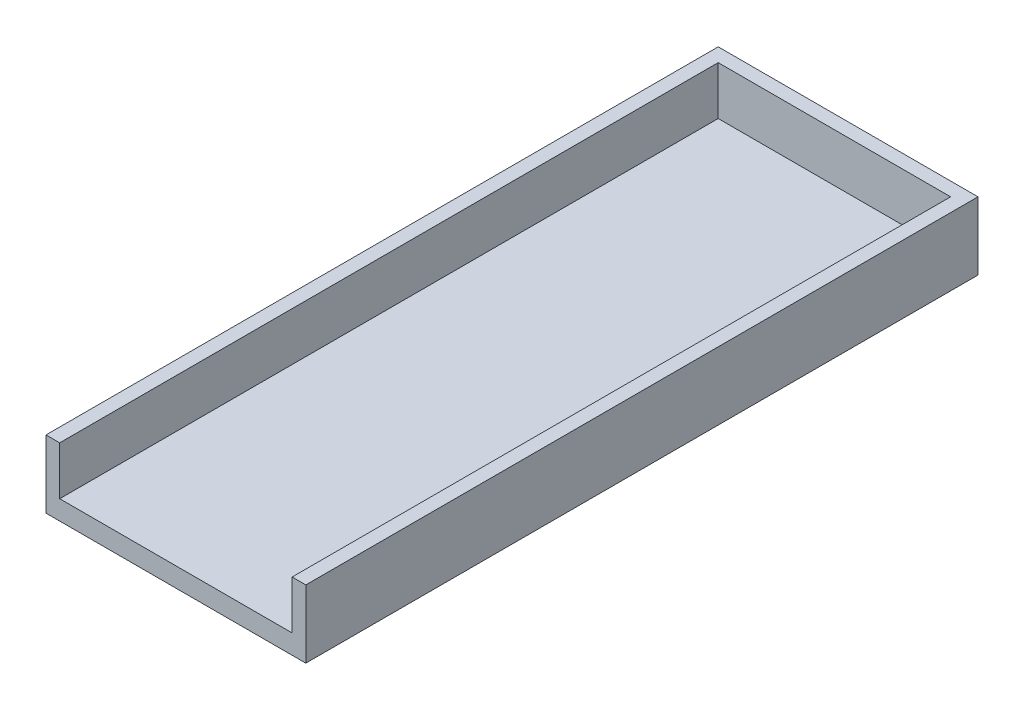
from build123d import *

# Parameters (mm, degrees)
SKETCH2_W             = 67.071067812
SKETCH2_H             = 337.071067812
SKETCH2_W_2           = 60
SKETCH2_H_2           = 330
BOSS_EXTRUDE1_DEPTH   = 12.5
SKETCH3_W             = 67.071067812
SKETCH3_H             = 337.071067812
BOSS_EXTRUDE2_DEPTH   = 5
BODY_MOVE_COPY2_ANGLE = 180
BOSS_EXTRUDE3_DEPTH   = 5


with BuildPart() as part:
    # Sketch2 → Boss-Extrude1 (new body)
    with BuildSketch(Plane(origin=(0, 0, 0), x_dir=(1, 0, 0), z_dir=(0, 1, 0))):
        with Locations((30, 165)):
            Rectangle(SKETCH2_W, SKETCH2_H)
        with Locations((30, 165)):
            Rectangle(SKETCH2_W_2, SKETCH2_H_2, mode=Mode.SUBTRACT)
    extrude(amount=BOSS_EXTRUDE1_DEPTH)

    # Sketch3 → Boss-Extrude2 (add)
    with BuildSketch(Plane.XZ):
        with Locations((30, -165)):
            Rectangle(SKETCH3_W, SKETCH3_H)
    extrude(amount=BOSS_EXTRUDE2_DEPTH)


with BuildPart() as body_2:
    # Split1: the piece on the far side of the plane
    add(part.part)
    split(bisect_by=Plane(origin=(0, 0, -165), x_dir=(-1, 0, 0), z_dir=(0, 0, -1)), keep=Keep.BOTTOM)


with BuildPart() as part_1:
    add(part.part)

    # Split1
    split(bisect_by=Plane(origin=(0, 0, -165), x_dir=(-1, 0, 0), z_dir=(0, 0, -1)), keep=Keep.TOP)

    # Sketch4 → Boss-Extrude3 (add)
    with BuildSketch(Plane.XY.offset(-165)):
        Polygon((60, 0), (0, 0), (0, 12.5), (-3.535533906, 12.5), (-3.535533906, -5), (63.535533906, -5), (63.535533906, 12.5), (60, 12.5), align=None)
    extrude(amount=BOSS_EXTRUDE3_DEPTH)


with BuildPart() as body_2_1:
    # Body-Move/Copy2: read off the stored shape, not the designer's step
    # Body-Move/Copy2: moved
    add(body_2.part.moved(Location((-127.0710678, -25, 0))).rotate(Axis((0, 0, 0), (0, 0, 1)), BODY_MOVE_COPY2_ANGLE))


solid = part_1.part
